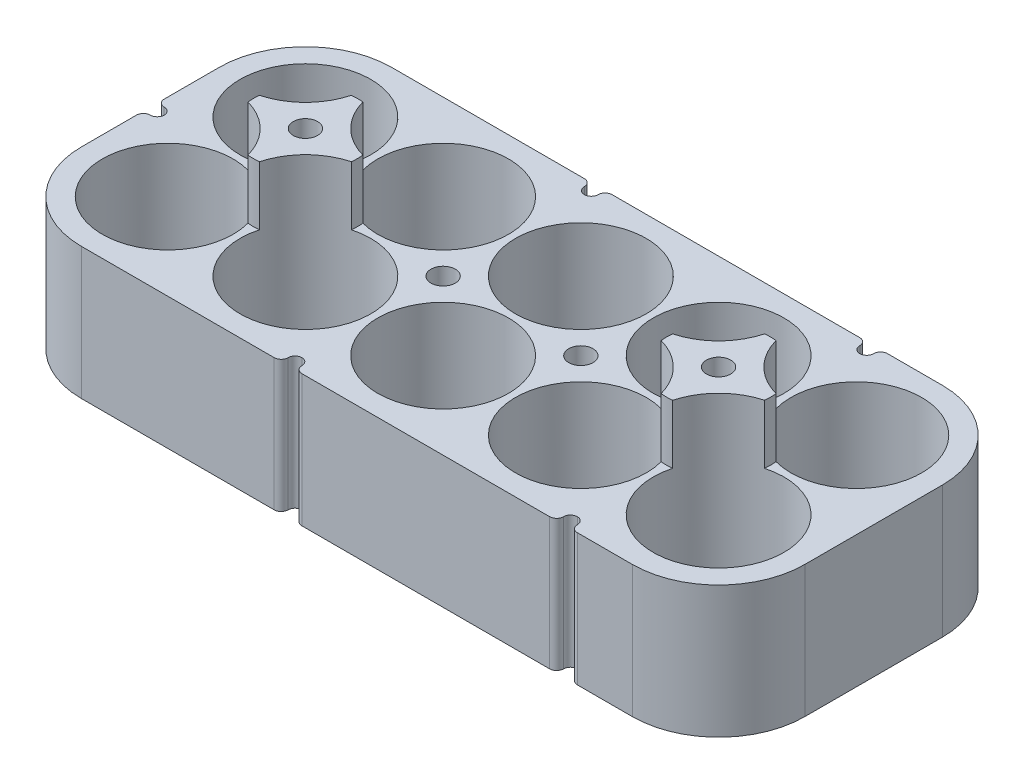
from build123d import *

# Parameters (mm, degrees)
SKETCH2_R               = 9.425
BOSS_EXTRUDE1_DEPTH     = 2.5
CUT_EXTRUDE3_DEPTH      = 57.769605644
CUT_EXTRUDE3_DEPTH_BACK = 57.769605644
SKETCH7_R               = 3
SKETCH7_R_2             = 1.75
SKETCH9_R               = 9.425
SKETCH9_R_2             = 3
BOSS_EXTRUDE2_DEPTH     = 3
SKETCH11_R              = 9.425
SKETCH11_R_2            = 3
SKETCH11_R_3            = 1.75
BOSS_EXTRUDE3_DEPTH     = 6
SKETCH12_R              = 9.425
SKETCH12_R_2            = 1.75
BOSS_EXTRUDE4_DEPTH     = 16
CUT_EXTRUDE4_DEPTH      = 3
SKETCH14_W              = 2
SKETCH14_H              = 2
CUT_EXTRUDE5_DEPTH      = 64.030057314
FILLET1_R               = 1
SKETCH15_W              = 104.25
SKETCH15_H              = 44.7
SKETCH15_R              = 7.5
CUT_EXTRUDE6_DEPTH      = 60.812524817


with BuildPart() as part:
    # Sketch2 → Boss-Extrude1 (new body)
    with BuildSketch(Plane(origin=(0, 0, 0), x_dir=(1, 0, 0), z_dir=(0, 1, 0))):
        with BuildLine():
            Line((-39.7, -22.35), (39.7, -22.35))
            ThreePointArc((39.7, -22.35), (48.485801756, -18.710801756), (52.125, -9.925))
            Line((52.125, -9.925), (52.125, 9.925))
            ThreePointArc((52.125, 9.925), (48.485801756, 18.710801756), (39.7, 22.35))
            Line((39.7, 22.35), (-39.7, 22.35))
            ThreePointArc((-39.7, 22.35), (-48.485801756, 18.710801756), (-52.125, 9.925))
            Line((-52.125, 9.925), (-52.125, -9.925))
            ThreePointArc((-52.125, -9.925), (-48.485801756, -18.710801756), (-39.7, -22.35))
        make_face()
        with Locations(Location((-19.85, 9.925, 0), (0, 0, 270))):
            Circle(SKETCH2_R, mode=Mode.SUBTRACT)
        with Locations(Location((-39.7, -9.925, 0), (0, 0, 270))):
            Circle(SKETCH2_R, mode=Mode.SUBTRACT)
        with Locations(Location((-39.7, 9.925, 0), (0, 0, 270))):
            Circle(SKETCH2_R, mode=Mode.SUBTRACT)
        with Locations(Location((-19.85, -9.925, 0), (0, 0, 270))):
            Circle(SKETCH2_R, mode=Mode.SUBTRACT)
        with Locations(Location((19.85, -9.925, 0), (0, 0, 270))):
            Circle(SKETCH2_R, mode=Mode.SUBTRACT)
        with Locations(Location((39.7, 9.925, 0), (0, 0, 270))):
            Circle(SKETCH2_R, mode=Mode.SUBTRACT)
        with Locations(Location((39.7, -9.925, 0), (0, 0, 270))):
            Circle(SKETCH2_R, mode=Mode.SUBTRACT)
        with Locations(Location((19.85, 9.925, 0), (0, 0, 270))):
            Circle(SKETCH2_R, mode=Mode.SUBTRACT)
        with Locations(Location((0, -9.925, 0), (0, 0, 270))):
            Circle(SKETCH2_R, mode=Mode.SUBTRACT)
        with Locations(Location((0, 9.925, 0), (0, 0, 270))):
            Circle(SKETCH2_R, mode=Mode.SUBTRACT)
    extrude(amount=BOSS_EXTRUDE1_DEPTH)

    # Sketch7 → Cut-Extrude3 (cut, two sides: drawn at the far end of the back side and taken through both)
    with BuildSketch(Plane(origin=(0, 0, 0), x_dir=(1, 0, 0), z_dir=(0, 1, 0)).offset(-CUT_EXTRUDE3_DEPTH_BACK)):
        with Locations(Location((-29.775, 0, 0), (0, 0, 270))):
            Circle(SKETCH7_R)
        with Locations(Location((-9.925, 0, 0), (0, 0, 270))):
            Circle(SKETCH7_R_2)
        with Locations(Location((9.925, 0, 0), (0, 0, 270))):
            Circle(SKETCH7_R_2)
        with Locations(Location((29.775, 0, 0), (0, 0, 270))):
            Circle(SKETCH7_R)
    extrude(amount=CUT_EXTRUDE3_DEPTH + CUT_EXTRUDE3_DEPTH_BACK, mode=Mode.SUBTRACT)

    # Sketch9 → Boss-Extrude2 (add)
    with BuildSketch(Plane(origin=(0, 2.5, 0), x_dir=(1, 0, 0), z_dir=(0, 1, 0))):
        with BuildLine():
            Line((39.7, -22.35), (-39.7, -22.35))
            ThreePointArc((-39.7, -22.35), (-48.485801756, -18.710801756), (-52.125, -9.925))
            Line((-52.125, -9.925), (-52.125, 9.925))
            ThreePointArc((-52.125, 9.925), (-48.485801756, 18.710801756), (-39.7, 22.35))
            Line((-39.7, 22.35), (39.7, 22.35))
            ThreePointArc((39.7, 22.35), (48.485801756, 18.710801756), (52.125, 9.925))
            Line((52.125, 9.925), (52.125, -9.925))
            ThreePointArc((52.125, -9.925), (48.485801756, -18.710801756), (39.7, -22.35))
        make_face()
        with Locations(Location((39.7, -9.925, 0), (0, 0, 270))):
            Circle(SKETCH9_R, mode=Mode.SUBTRACT)
        with Locations(Location((19.85, -9.925, 0), (0, 0, 270))):
            Circle(SKETCH9_R, mode=Mode.SUBTRACT)
        with Locations(Location((0, -9.925, 0), (0, 0, 270))):
            Circle(SKETCH9_R, mode=Mode.SUBTRACT)
        with Locations(Location((-19.85, -9.925, 0), (0, 0, 270))):
            Circle(SKETCH9_R, mode=Mode.SUBTRACT)
        with Locations(Location((-39.7, -9.925, 0), (0, 0, 270))):
            Circle(SKETCH9_R, mode=Mode.SUBTRACT)
        with Locations(Location((-39.7, 9.925, 0), (0, 0, 270))):
            Circle(SKETCH9_R, mode=Mode.SUBTRACT)
        with Locations(Location((-19.85, 9.925, 0), (0, 0, 270))):
            Circle(SKETCH9_R, mode=Mode.SUBTRACT)
        with Locations(Location((0, 9.925, 0), (0, 0, 270))):
            Circle(SKETCH9_R, mode=Mode.SUBTRACT)
        with Locations(Location((19.85, 9.925, 0), (0, 0, 270))):
            Circle(SKETCH9_R, mode=Mode.SUBTRACT)
        with Locations(Location((39.7, 9.925, 0), (0, 0, 270))):
            Circle(SKETCH9_R, mode=Mode.SUBTRACT)
        with Locations(Location((29.775, 0, 0), (0, 0, 270))):
            Circle(SKETCH9_R_2, mode=Mode.SUBTRACT)
        with Locations(Location((-29.775, 0, 0), (0, 0, 270))):
            Circle(SKETCH9_R_2, mode=Mode.SUBTRACT)
        Polygon((6.460898385, 0), (8.192949192, -3), (11.657050808, -3), (13.389101615, 0), (11.657050808, 3), (8.192949192, 3), align=None, mode=Mode.SUBTRACT)
        Polygon((-6.460898385, 0), (-8.192949192, 3), (-11.657050808, 3), (-13.389101615, 0), (-11.657050808, -3), (-8.192949192, -3), align=None, mode=Mode.SUBTRACT)
    extrude(amount=BOSS_EXTRUDE2_DEPTH)

    # Sketch11 → Boss-Extrude3 (add)
    with BuildSketch(Plane(origin=(0, 5.5, 0), x_dir=(1, 0, 0), z_dir=(0, 1, 0))):
        with BuildLine():
            Line((39.7, -22.35), (-39.7, -22.35))
            ThreePointArc((-39.7, -22.35), (-48.485801756, -18.710801756), (-52.125, -9.925))
            Line((-52.125, -9.925), (-52.125, 9.925))
            ThreePointArc((-52.125, 9.925), (-48.485801756, 18.710801756), (-39.7, 22.35))
            Line((-39.7, 22.35), (39.7, 22.35))
            ThreePointArc((39.7, 22.35), (48.485801756, 18.710801756), (52.125, 9.925))
            Line((52.125, 9.925), (52.125, -9.925))
            ThreePointArc((52.125, -9.925), (48.485801756, -18.710801756), (39.7, -22.35))
        make_face()
        with Locations(Location((39.7, -9.925, 0), (0, 0, 270))):
            Circle(SKETCH11_R, mode=Mode.SUBTRACT)
        with Locations(Location((19.85, -9.925, 0), (0, 0, 270))):
            Circle(SKETCH11_R, mode=Mode.SUBTRACT)
        with Locations(Location((0, -9.925, 0), (0, 0, 270))):
            Circle(SKETCH11_R, mode=Mode.SUBTRACT)
        with Locations(Location((-19.85, -9.925, 0), (0, 0, 270))):
            Circle(SKETCH11_R, mode=Mode.SUBTRACT)
        with Locations(Location((-39.7, -9.925, 0), (0, 0, 270))):
            Circle(SKETCH11_R, mode=Mode.SUBTRACT)
        with Locations(Location((-39.7, 9.925, 0), (0, 0, 270))):
            Circle(SKETCH11_R, mode=Mode.SUBTRACT)
        with Locations(Location((-19.85, 9.925, 0), (0, 0, 270))):
            Circle(SKETCH11_R, mode=Mode.SUBTRACT)
        with Locations(Location((0, 9.925, 0), (0, 0, 270))):
            Circle(SKETCH11_R, mode=Mode.SUBTRACT)
        with Locations(Location((19.85, 9.925, 0), (0, 0, 270))):
            Circle(SKETCH11_R, mode=Mode.SUBTRACT)
        with Locations(Location((39.7, 9.925, 0), (0, 0, 270))):
            Circle(SKETCH11_R, mode=Mode.SUBTRACT)
        with Locations(Location((29.775, 0, 0), (0, 0, 270))):
            Circle(SKETCH11_R_2, mode=Mode.SUBTRACT)
        with Locations(Location((-29.775, 0, 0), (0, 0, 270))):
            Circle(SKETCH11_R_2, mode=Mode.SUBTRACT)
        with Locations(Location((-9.925, 0, 0), (0, 0, 270))):
            Circle(SKETCH11_R_3, mode=Mode.SUBTRACT)
        with Locations(Location((9.925, 0, 0), (0, 0, 270))):
            Circle(SKETCH11_R_3, mode=Mode.SUBTRACT)
    extrude(amount=BOSS_EXTRUDE3_DEPTH)

    # Sketch12 → Boss-Extrude4 (add)
    with BuildSketch(Plane(origin=(0, 11.5, 0), x_dir=(1, 0, 0), z_dir=(0, 1, 0))):
        with BuildLine():
            Line((39.7, -22.35), (-39.7, -22.35))
            ThreePointArc((-39.7, -22.35), (-48.485801756, -18.710801756), (-52.125, -9.925))
            Line((-52.125, -9.925), (-52.125, 9.925))
            ThreePointArc((-52.125, 9.925), (-48.485801756, 18.710801756), (-39.7, 22.35))
            Line((-39.7, 22.35), (39.7, 22.35))
            ThreePointArc((39.7, 22.35), (48.485801756, 18.710801756), (52.125, 9.925))
            Line((52.125, 9.925), (52.125, -9.925))
            ThreePointArc((52.125, -9.925), (48.485801756, -18.710801756), (39.7, -22.35))
        make_face()
        with Locations(Location((39.7, -9.925, 0), (0, 0, 270))):
            Circle(SKETCH12_R, mode=Mode.SUBTRACT)
        with Locations(Location((19.85, -9.925, 0), (0, 0, 270))):
            Circle(SKETCH12_R, mode=Mode.SUBTRACT)
        with Locations(Location((0, -9.925, 0), (0, 0, 270))):
            Circle(SKETCH12_R, mode=Mode.SUBTRACT)
        with Locations(Location((-19.85, -9.925, 0), (0, 0, 270))):
            Circle(SKETCH12_R, mode=Mode.SUBTRACT)
        with Locations(Location((-39.7, -9.925, 0), (0, 0, 270))):
            Circle(SKETCH12_R, mode=Mode.SUBTRACT)
        with Locations(Location((-39.7, 9.925, 0), (0, 0, 270))):
            Circle(SKETCH12_R, mode=Mode.SUBTRACT)
        with Locations(Location((-19.85, 9.925, 0), (0, 0, 270))):
            Circle(SKETCH12_R, mode=Mode.SUBTRACT)
        with Locations(Location((0, 9.925, 0), (0, 0, 270))):
            Circle(SKETCH12_R, mode=Mode.SUBTRACT)
        with Locations(Location((19.85, 9.925, 0), (0, 0, 270))):
            Circle(SKETCH12_R, mode=Mode.SUBTRACT)
        with Locations(Location((39.7, 9.925, 0), (0, 0, 270))):
            Circle(SKETCH12_R, mode=Mode.SUBTRACT)
        with Locations(Location((29.775, 0, 0), (0, 0, 270))):
            Circle(SKETCH12_R_2, mode=Mode.SUBTRACT)
        with Locations(Location((9.925, 0, 0), (0, 0, 270))):
            Circle(SKETCH12_R_2, mode=Mode.SUBTRACT)
        with Locations(Location((-9.925, 0, 0), (0, 0, 270))):
            Circle(SKETCH12_R_2, mode=Mode.SUBTRACT)
        with Locations(Location((-29.775, 0, 0), (0, 0, 270))):
            Circle(SKETCH12_R_2, mode=Mode.SUBTRACT)
    extrude(amount=BOSS_EXTRUDE4_DEPTH)

    # Sketch13 → Cut-Extrude4 (cut)
    with BuildSketch(Plane(origin=(0, 22.5, 0), x_dir=(1, 0, 0), z_dir=(0, 1, 0))):
        Polygon((-28.042949192, -3), (-26.310898385, 0), (-28.042949192, 3), (-31.507050808, 3), (-33.239101615, 0), (-31.507050808, -3), align=None)
        Polygon((28.042949192, -3), (31.507050808, -3), (33.239101615, 0), (31.507050808, 3), (28.042949192, 3), (26.310898385, 0), align=None)
    extrude(amount=-CUT_EXTRUDE4_DEPTH, mode=Mode.SUBTRACT)

    # Sketch14 → Cut-Extrude5 (cut, through all)
    with BuildSketch(Plane(origin=(0, 27.5, 0), x_dir=(1, 0, 0), z_dir=(0, 1, 0))):
        with Locations((-51.125, 0)):
            Rectangle(SKETCH14_W, SKETCH14_H)
        with Locations((29.775, -21.35)):
            Rectangle(SKETCH14_W, SKETCH14_H)
        with Locations((-9.925, -21.35)):
            Rectangle(SKETCH14_W, SKETCH14_H)
        with Locations((-9.925, 21.35)):
            Rectangle(SKETCH14_W, SKETCH14_H)
        with Locations((29.775, 21.35)):
            Rectangle(SKETCH14_W, SKETCH14_H)
    extrude(amount=-CUT_EXTRUDE5_DEPTH, mode=Mode.SUBTRACT)

    # Fillet1
    fillet1_edges = [part.edges().sort_by_distance(p)[0] for p in [
        (28.775, 13.75, -20.35),
        (30.775, 13.75, -20.35),
        (-10.925, 13.75, -20.35),
        (-8.925, 13.75, -20.35),
        (-50.125, 13.75, 1),
        (-50.125, 13.75, -1),
        (30.775, 13.75, 20.35),
        (28.775, 13.75, 20.35),
        (-8.925, 13.75, 20.35),
        (-10.925, 13.75, 20.35),
    ]]
    fillet(fillet1_edges, radius=FILLET1_R - 0.0001)  # a hair under: the kernel refuses the full size
    fillet1_2_edges = [part.edges().sort_by_distance(p)[0] for p in [
        (28.775, 27.5, -21.84995),
        (30.775, 27.5, -21.84995),
        (-10.925, 27.5, -21.84995),
        (-8.925, 27.5, -21.84995),
        (-51.62495, 27.5, 1),
        (-51.62495, 27.5, -1),
        (30.775, 27.5, 21.84995),
        (28.775, 27.5, 21.84995),
        (-8.925, 27.5, 21.84995),
        (-10.925, 27.5, 21.84995),
        (30.775, 13.75, -22.35),
        (28.775, 13.75, -22.35),
        (-8.925, 13.75, -22.35),
        (-10.925, 13.75, -22.35),
        (-52.125, 13.75, 1),
        (-52.125, 13.75, -1),
        (30.775, 13.75, 22.35),
        (28.775, 13.75, 22.35),
        (-8.925, 13.75, 22.35),
        (-10.925, 13.75, 22.35),
        (-10.632136071, 27.5, 20.642863929),
        (-9.217863929, 27.5, 20.642863929),
        (29.067863929, 27.5, 20.642863929),
        (30.482136071, 27.5, 20.642863929),
        (-50.417863929, 27.5, -0.707136071),
        (-50.417863929, 27.5, 0.707136071),
        (-9.217863929, 27.5, -20.642863929),
        (-10.632136071, 27.5, -20.642863929),
        (30.482136071, 27.5, -20.642863929),
        (29.067863929, 27.5, -20.642863929),
    ]]
    fillet(fillet1_2_edges, radius=FILLET1_R - 0.0001)  # a hair under: the kernel refuses the full size

    # Sketch15 → Cut-Extrude6 (cut, through all)
    with BuildSketch(Plane(origin=(0, 19, 0), x_dir=(1, 0, 0), z_dir=(0, 1, 0))):
        Rectangle(SKETCH15_W, SKETCH15_H)
        with Locations((-29.775, 0)):
            Circle(SKETCH15_R, mode=Mode.SUBTRACT)
        with Locations((29.775, 0)):
            Circle(SKETCH15_R, mode=Mode.SUBTRACT)
    extrude(amount=CUT_EXTRUDE6_DEPTH, mode=Mode.SUBTRACT)


solid = part.part
